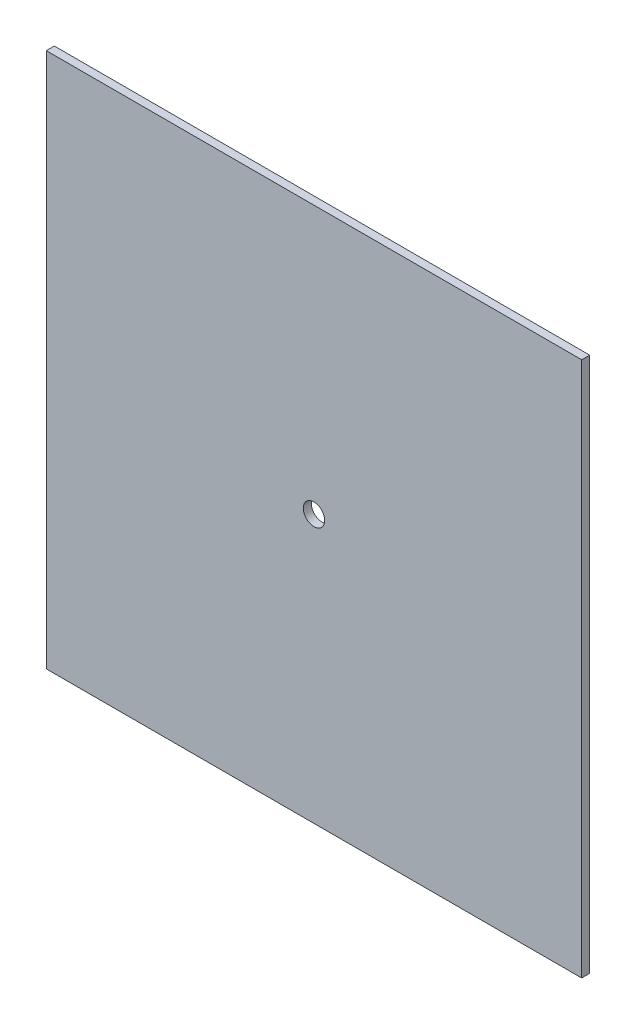
from build123d import *

# Parameters (mm, degrees)
BASEPLATE_W         = 200
BASEPLATE_H         = 200
BOSS_EXTRUDE1_DEPTH = 3
SKETCH3_R           = 4
CUT_EXTRUDE1_DEPTH  = 3


with BuildPart() as part:
    # Baseplate → Boss-Extrude1 (new body)
    with BuildSketch(Plane.XY):
        Rectangle(BASEPLATE_W, BASEPLATE_H)
    extrude(amount=BOSS_EXTRUDE1_DEPTH)

    # Sketch3 → Cut-Extrude1 (cut)
    with BuildSketch(Plane.XY.offset(3)):
        Circle(SKETCH3_R)
    extrude(amount=-CUT_EXTRUDE1_DEPTH, mode=Mode.SUBTRACT)


solid = part.part
